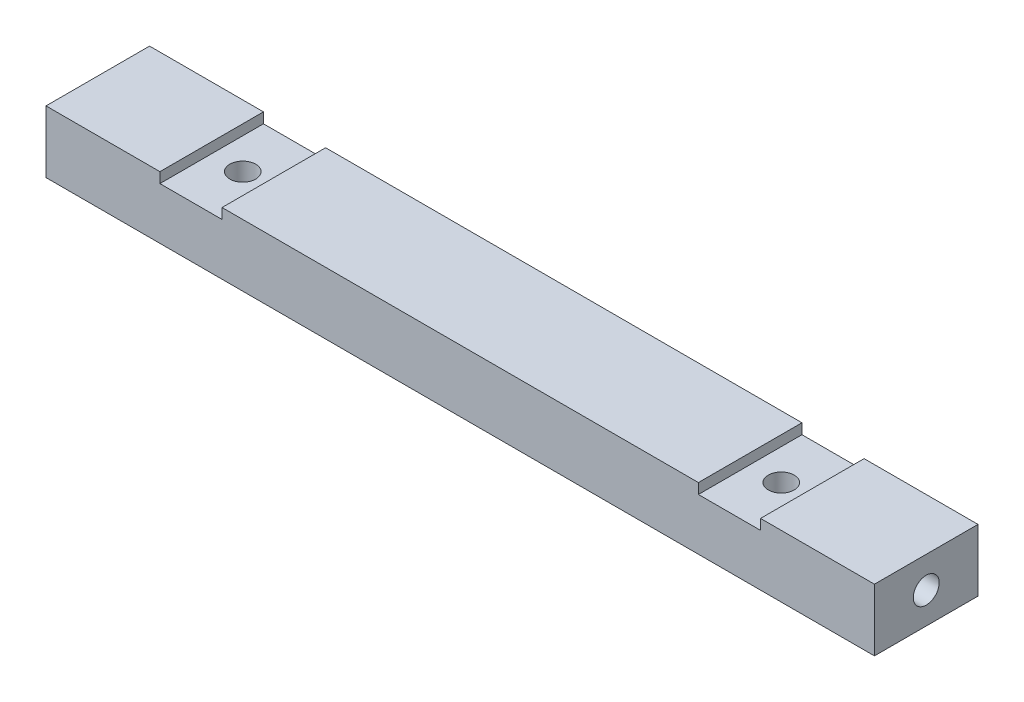
from build123d import *

# Parameters (mm, degrees)
SKETCH1_W                                 = 80
SKETCH1_H                                 = 10
BOSS_EXTRUDE1_DEPTH                       = 6
SKETCH2_W                                 = 6
SKETCH2_H                                 = 10
CUT_EXTRUDE1_DEPTH                        = 1
TAP_DRILL_FOR_M3X0_5_TAP1_D               = 2.5
TAP_DRILL_FOR_M3X0_5_TAP1_DEPTH           = 10
TAP_DRILL_FOR_M3X0_5_TAP1_TIP             = 0.751075774
TAP_DRILL_FOR_M3X0_5_TAP1_ON_FACE_2_D     = 2.5
TAP_DRILL_FOR_M3X0_5_TAP1_ON_FACE_2_DEPTH = 10
TAP_DRILL_FOR_M3X0_5_TAP1_ON_FACE_2_TIP   = 0.751075774
TAP_DRILL_FOR_M3X0_5_TAP1_ON_FACE_3_D     = 2.5
TAP_DRILL_FOR_M3X0_5_TAP1_ON_FACE_3_DEPTH = 10
TAP_DRILL_FOR_M3X0_5_TAP1_ON_FACE_3_TIP   = 0.751075774
CHAMFER1_SIZE                             = 1.5


with BuildPart() as part:
    # Sketch1 → Boss-Extrude1 (new body)
    with BuildSketch(Plane(origin=(0, 0, 0), x_dir=(1, 0, 0), z_dir=(0, 1, 0))):
        with Locations((40, 5)):
            Rectangle(SKETCH1_W, SKETCH1_H)
    extrude(amount=BOSS_EXTRUDE1_DEPTH)

    # Sketch2 → Cut-Extrude1 (cut)
    with BuildSketch(Plane(origin=(0, 6, 0), x_dir=(1, 0, 0), z_dir=(0, 1, 0))):
        with Locations((14, 5)):
            Rectangle(SKETCH2_W, SKETCH2_H)
        with Locations((66, 5)):
            Rectangle(SKETCH2_W, SKETCH2_H)
    extrude(amount=-CUT_EXTRUDE1_DEPTH, mode=Mode.SUBTRACT)

    # Tap Drill for M3x0.5 Tap1
    with Locations(Plane(origin=(80, 3, -5), x_dir=(0, 0, 1), z_dir=(1, 0, 0))):
        with Locations((0, 0)):
            Hole(TAP_DRILL_FOR_M3X0_5_TAP1_D / 2, depth=TAP_DRILL_FOR_M3X0_5_TAP1_DEPTH)
            with Locations((0, 0, -(TAP_DRILL_FOR_M3X0_5_TAP1_DEPTH + TAP_DRILL_FOR_M3X0_5_TAP1_TIP / 2))):  # 118° drill point
                Cone(0, TAP_DRILL_FOR_M3X0_5_TAP1_D / 2, TAP_DRILL_FOR_M3X0_5_TAP1_TIP, mode=Mode.SUBTRACT)

    # Tap Drill for M3x0.5 Tap1 on face 2
    with Locations(Plane(origin=(66, 0, -5), x_dir=(0, 0, -1), z_dir=(0, -1, 0))):
        with Locations((0, 0), (0, -52)):
            Hole(TAP_DRILL_FOR_M3X0_5_TAP1_ON_FACE_2_D / 2, depth=TAP_DRILL_FOR_M3X0_5_TAP1_ON_FACE_2_DEPTH)
            with Locations((0, 0, -(TAP_DRILL_FOR_M3X0_5_TAP1_ON_FACE_2_DEPTH + TAP_DRILL_FOR_M3X0_5_TAP1_ON_FACE_2_TIP / 2))):  # 118° drill point
                Cone(0, TAP_DRILL_FOR_M3X0_5_TAP1_ON_FACE_2_D / 2, TAP_DRILL_FOR_M3X0_5_TAP1_ON_FACE_2_TIP, mode=Mode.SUBTRACT)

    # Tap Drill for M3x0.5 Tap1 on face 3
    with Locations(Plane(origin=(0, 3, -5), x_dir=(0, 0, -1), z_dir=(-1, 0, 0))):
        with Locations((0, 0)):
            Hole(TAP_DRILL_FOR_M3X0_5_TAP1_ON_FACE_3_D / 2, depth=TAP_DRILL_FOR_M3X0_5_TAP1_ON_FACE_3_DEPTH)
            with Locations((0, 0, -(TAP_DRILL_FOR_M3X0_5_TAP1_ON_FACE_3_DEPTH + TAP_DRILL_FOR_M3X0_5_TAP1_ON_FACE_3_TIP / 2))):  # 118° drill point
                Cone(0, TAP_DRILL_FOR_M3X0_5_TAP1_ON_FACE_3_D / 2, TAP_DRILL_FOR_M3X0_5_TAP1_ON_FACE_3_TIP, mode=Mode.SUBTRACT)

    # Chamfer1
    chamfer1_edges = [part.edges().sort_by_distance(p)[0] for p in [
        (66, 0, -6.25),
        (14, 0, -6.25),
    ]]
    chamfer(chamfer1_edges, length=CHAMFER1_SIZE)


solid = part.part
